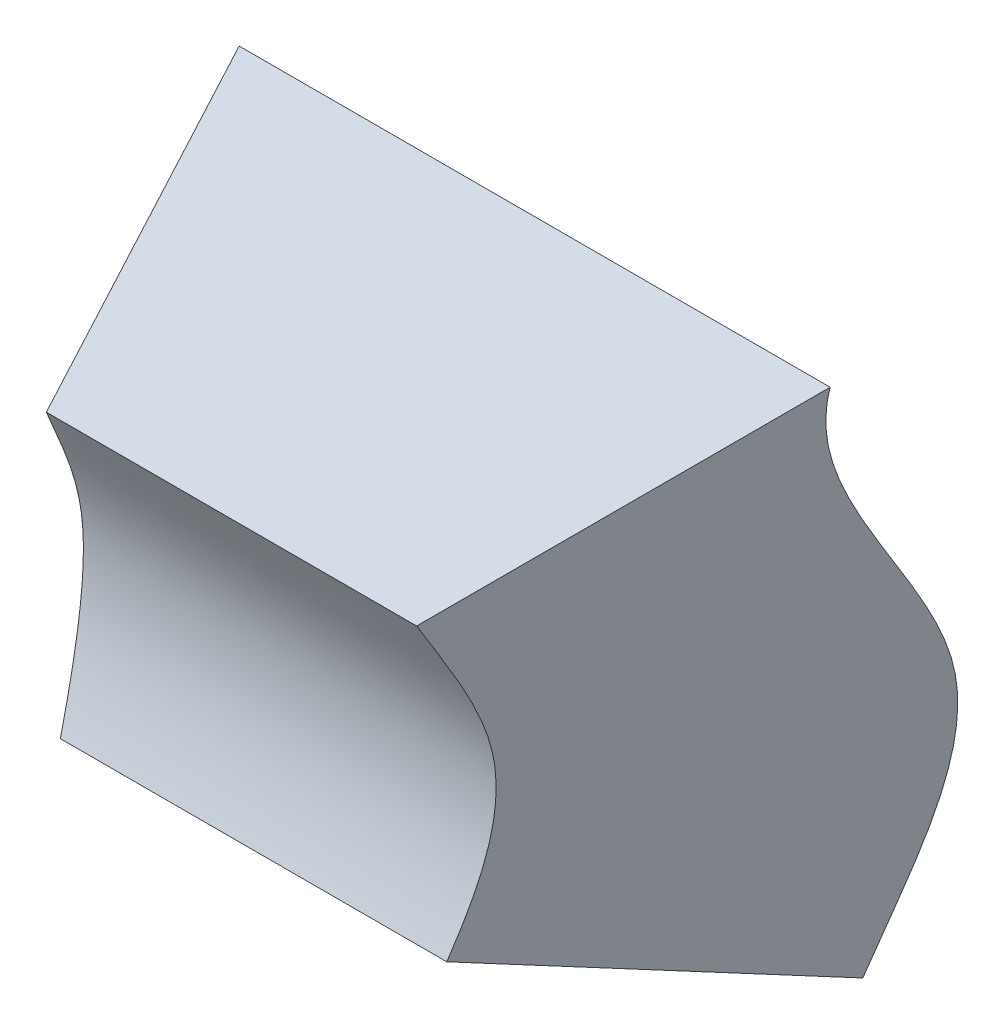
from build123d import *

# Parameters (mm, degrees)
F_1_FR_W        = 43.350723316
F_1_FR_H        = 38.259713105
EXTRUDE_1_DEPTH = 20
EXTRUDE_1_TAPER = 20
OTHER_START     = -1
OTHER_1_DEPTH   = 45
OTHER_START_2   = 7.279404685
OTHER_1_2_DEPTH = 28.791913946
OTHER_START_3   = -35.822740595
OTHER_1_3_DEPTH = 32.835074171


with BuildPart() as part:
    # Эскиз1_fr → Бобышка-Вытянуть1 (new body)
    with BuildSketch(Plane.XY):
        with Locations((21.675361658, -19.129856553)):
            Rectangle(F_1_FR_W, F_1_FR_H)
    extrude(amount=EXTRUDE_1_DEPTH, taper=EXTRUDE_1_TAPER)

    # Заменить грань1: read off the stored shape, not the designer's step
    # Заменить грань1 outline → Заменить грань1 (cut)
    with BuildSketch(Plane.YZ.offset(OTHER_START)):
        with BuildLine():
            Line((0, 0), (-2.987666524, 8.208546313))
            add(Edge.make_bspline(
                [(-2.987666524, 8.208546313), (-8.870550538, 9.578826995), (-19.207758762, -1.740918138), (-30.435430933, 4.410138177), (-35.822740495, 6.695527216)],
                knots=[0.134570032, 0.134570032, 0.134570032, 0.134570032, 0.484609084, 0.79490495, 0.79490495, 0.79490495, 0.79490495], degree=3))
            Line((-35.822740495, 6.695527216), (-38.259713105, 0))
            Line((-38.259713105, 0), (0, 0))
        make_face()
    extrude(amount=OTHER_1_DEPTH, mode=Mode.SUBTRACT)

    # Other 1 2 outline → Other 1 2 (add)
    with BuildSketch(Plane.YZ.offset(OTHER_START_2)):
        with BuildLine():
            Line((-7.279404685, 20), (-9.965660529, 27.380427273))
            add(Edge.make_bspline(
                [(-9.965660529, 27.380427273), (-12.601354954, 25.979247634), (-18.69943354, 22.300628932), (-25.092854244, 24.416589038), (-28.802415021, 25.983712933)],
                knots=[0.320991938, 0.320991938, 0.320991938, 0.320991938, 0.484609084, 0.701285336, 0.701285336, 0.701285336, 0.701285336], degree=3))
            Line((-28.802415021, 25.983712933), (-30.980308419, 20))
            Line((-30.980308419, 20), (-7.279404685, 20))
        make_face()
    extrude(amount=OTHER_1_2_DEPTH)

    # Other 1 3 outline → Other 1 3 (cut)
    with BuildSketch(Plane(origin=(0, 0, 0), x_dir=(1, 0, 0), z_dir=(0, 1, 0)).offset(OTHER_START_3)):
        Polygon((9.965660529, -27.380427273), (7.279404685, -20), (7.279404685, -29), (10.555136794, -29), align=None)
        Polygon((33.385062787, -27.380427273), (32.795586522, -29), (36.071318631, -29), (36.071318631, -20), align=None)
    extrude(amount=OTHER_1_3_DEPTH, mode=Mode.SUBTRACT)


solid = part.part
